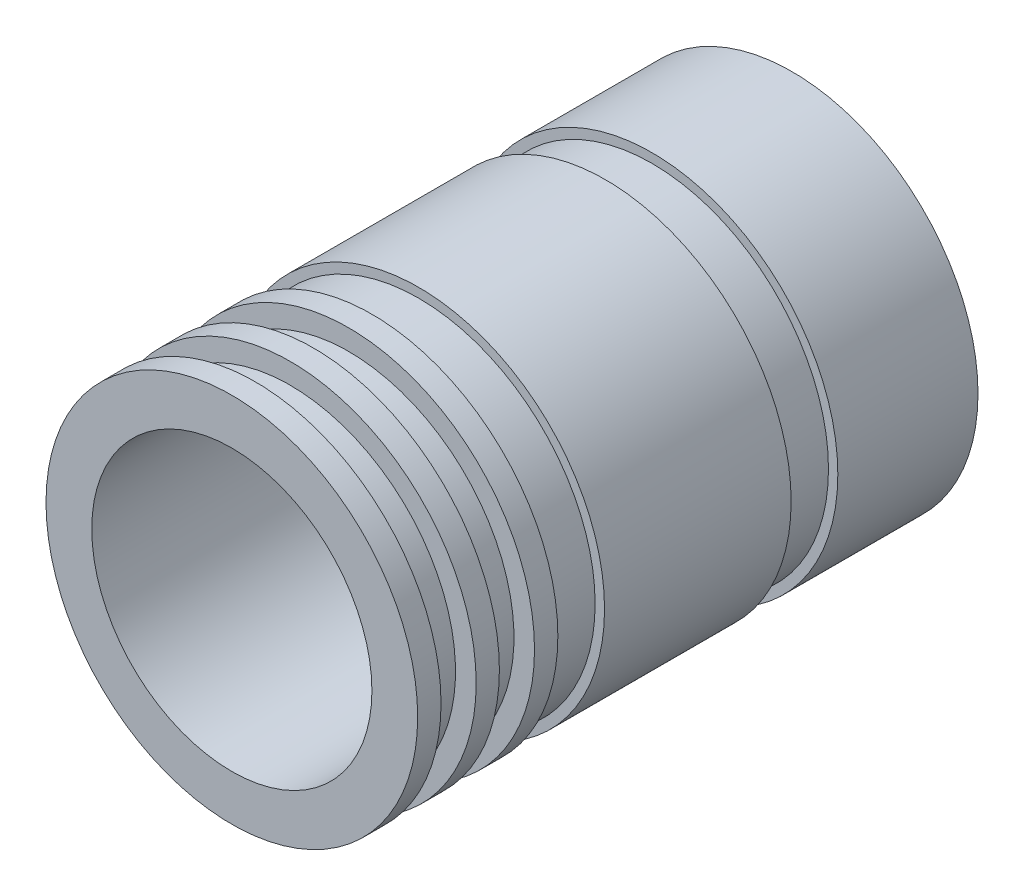
from build123d import *

# Parameters (mm, degrees)
SKETCH1_R           = 25.273
BOSS_EXTRUDE1_DEPTH = 76.2
SKETCH5_R           = 19.05
CUT_EXTRUDE2_DEPTH  = 76.2


with BuildPart() as part:
    # Sketch1 → Boss-Extrude1 (new body)
    with BuildSketch(Plane.XY):
        Circle(SKETCH1_R)
    extrude(amount=BOSS_EXTRUDE1_DEPTH)

    # Sketch5 → Cut-Extrude2 (cut)
    with BuildSketch(Plane.XY.offset(76.2)):
        Circle(SKETCH5_R)
    extrude(amount=-CUT_EXTRUDE2_DEPTH, mode=Mode.SUBTRACT)

    # Cut-Sweep4: sweep along a path in groove path
    with BuildLine(Plane.XY.offset(60.3123)) as cut_sweep4_path:
        CenterArc((0, 0), 25.273, 0, 360)
    # Groove → Cut-Sweep4 (sweep, cut)
    with BuildSketch(Plane(origin=(0, 0, 0), x_dir=(0, 0, -1), z_dir=(1, 0, 0))):
        Polygon((-73.025, 25.273), (-73.025, 22.479), (-68.2625, 22.479), (-68.244704377, 25.273), (-65.0875, 25.273), (-65.0875, 22.479), (-60.3123, 22.479), (-60.3123, 25.273), (-57.1373, 25.273), (-57.1373, 24.003), (-50.8, 24.003), (-50.7873, 25.273), (-50.7873, 27.723939067), (-73.025, 27.723939067), align=None)
        Polygon((-19.0627, 27.723939067), (-25.4127, 27.723939067), (-25.4127, 25.273), (-25.4, 24.003), (-19.0627, 24.003), (-19.0627, 25.273), align=None)
    sweep(path=cut_sweep4_path.line, mode=Mode.SUBTRACT)

    # Cut-Sweep5: sweep along a path in Sketch14
    with BuildLine(Plane(origin=(0, 0, 11.0656468), x_dir=(-1, 0, 0), z_dir=(0, 0, -1))) as cut_sweep5_path:
        CenterArc((0, 0), 19.05, 0, 360)
    # Sketch6 → Cut-Sweep5 (sweep, cut)
    with BuildSketch(Plane(origin=(0, 0, 0), x_dir=(0, 0, -1), z_dir=(1, 0, 0))):
        Polygon((-3.1281468, 0), (-15.8281468, 0), (-15.8281468, 21.844320112), (-11.1125, 21.844320112), (-11.1125, 18.034), (-7.9375, 18.034), (-7.9375, 21.844), (-3.1281468, 21.844), align=None)
    sweep(path=cut_sweep5_path.line, mode=Mode.SUBTRACT)


solid = part.part
